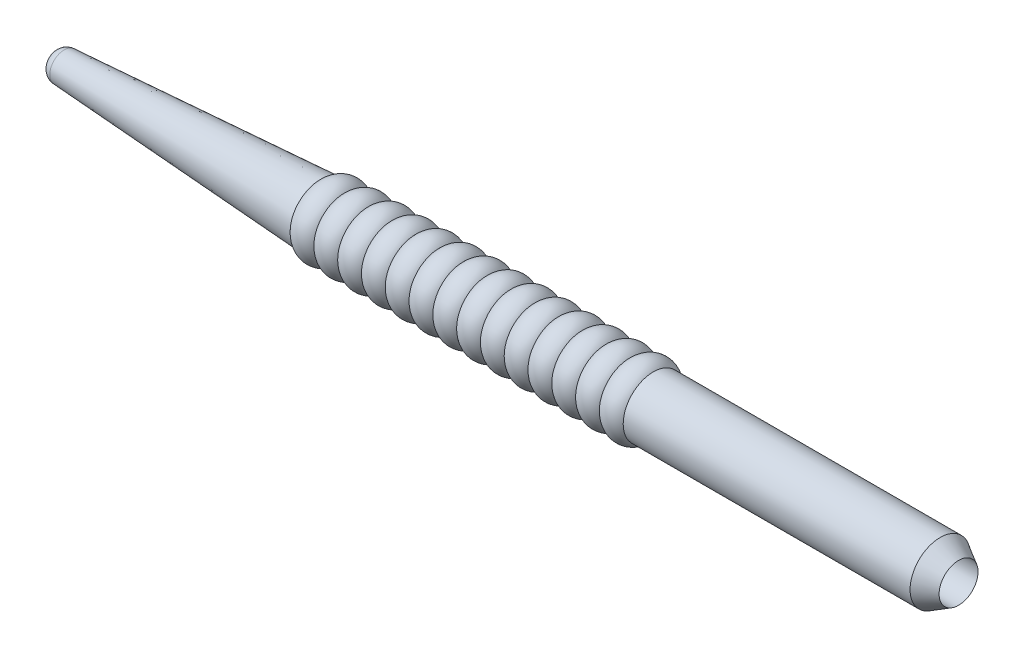
from build123d import *


with BuildPart() as part:
    # Sketch2 → Revolve2 (revolve)
    with BuildSketch(Plane.XY):
        with BuildLine():
            Line((0, 0.6), (50, 3.658131008))
            Line((50, 3.658131008), (50, 5.658131008))
            Line((50, 5.658131008), (1.870676808, 2.714415495))
            ThreePointArc((1.870676808, 2.714415495), (0.497428617, 2.0446376), (0, 0.6))
        make_face()
    revolve(axis=Axis((-19.275847123, 0, 0), (1, 0, 0)))

    # Sketch4 → Revolve3 (revolve)
    with BuildSketch(Plane.XY):
        with BuildLine():
            Line((112.60990337, 5.658131008), (120, 5.658131008))
            Line((120, 5.658131008), (120, 3.658131008))
            Line((120, 3.658131008), (112.60990337, 3.658131008))
            ThreePointArc((112.60990337, 3.658131008), (110.373835392, 2.658131008), (108.137767415, 3.658131008))
            ThreePointArc((108.137767415, 3.658131008), (105.901699437, 2.658131008), (103.66563146, 3.658131008))
            ThreePointArc((103.66563146, 3.658131008), (101.429563482, 2.658131008), (99.193495505, 3.658131008))
            ThreePointArc((99.193495505, 3.658131008), (96.957427527, 2.658131008), (94.72135955, 3.658131008))
            ThreePointArc((94.72135955, 3.658131008), (92.485291572, 2.658131008), (90.249223595, 3.658131008))
            ThreePointArc((90.249223595, 3.658131008), (88.013155617, 2.658131008), (85.77708764, 3.658131008))
            ThreePointArc((85.77708764, 3.658131008), (83.541019662, 2.658131008), (81.304951685, 3.658131008))
            ThreePointArc((81.304951685, 3.658131008), (79.068883707, 2.658131008), (76.83281573, 3.658131008))
            ThreePointArc((76.83281573, 3.658131008), (74.596747752, 2.658131008), (72.360679775, 3.658131008))
            ThreePointArc((72.360679775, 3.658131008), (70.124611797, 2.658131008), (67.88854382, 3.658131008))
            ThreePointArc((67.88854382, 3.658131008), (65.652475842, 2.658131008), (63.416407865, 3.658131008))
            ThreePointArc((63.416407865, 3.658131008), (61.180339887, 2.658131008), (58.94427191, 3.658131008))
            ThreePointArc((58.94427191, 3.658131008), (56.708203932, 2.658131008), (54.472135955, 3.658131008))
            ThreePointArc((54.472135955, 3.658131008), (52.236067977, 2.658131008), (50, 3.658131008))
            Line((50, 3.658131008), (50, 5.658131008))
            ThreePointArc((50, 5.658131008), (52.236067977, 6.658131008), (54.472135955, 5.658131008))
            ThreePointArc((54.472135955, 5.658131008), (56.708203932, 6.658131008), (58.94427191, 5.658131008))
            ThreePointArc((58.94427191, 5.658131008), (61.180339887, 6.658131008), (63.416407865, 5.658131008))
            ThreePointArc((63.416407865, 5.658131008), (65.652475842, 6.658131008), (67.88854382, 5.658131008))
            ThreePointArc((67.88854382, 5.658131008), (70.124611797, 6.658131008), (72.360679775, 5.658131008))
            ThreePointArc((72.360679775, 5.658131008), (74.596747752, 6.658131008), (76.83281573, 5.658131008))
            ThreePointArc((76.83281573, 5.658131008), (79.068883707, 6.658131008), (81.304951685, 5.658131008))
            ThreePointArc((81.304951685, 5.658131008), (83.541019662, 6.658131008), (85.77708764, 5.658131008))
            ThreePointArc((85.77708764, 5.658131008), (88.013155617, 6.658131008), (90.249223595, 5.658131008))
            ThreePointArc((90.249223595, 5.658131008), (92.485291572, 6.658131008), (94.72135955, 5.658131008))
            ThreePointArc((94.72135955, 5.658131008), (96.957427527, 6.658131008), (99.193495505, 5.658131008))
            ThreePointArc((99.193495505, 5.658131008), (101.429563482, 6.658131008), (103.66563146, 5.658131008))
            ThreePointArc((103.66563146, 5.658131008), (105.901699437, 6.658131008), (108.137767415, 5.658131008))
            ThreePointArc((108.137767415, 5.658131008), (110.373835392, 6.658131008), (112.60990337, 5.658131008))
        make_face()
    revolve(axis=Axis((21.024758235, 0, 0), (1, 0, 0)))

    # Sketch5 → Revolve4 (revolve)
    with BuildSketch(Plane.XY):
        Polygon((120, 3.658131008), (120, 5.658131008), (166.535898385, 5.658131008), (170, 3.658131008), align=None)
    revolve(axis=Axis((115.901619412, 0, 0), (1, 0, 0)))


solid = part.part
